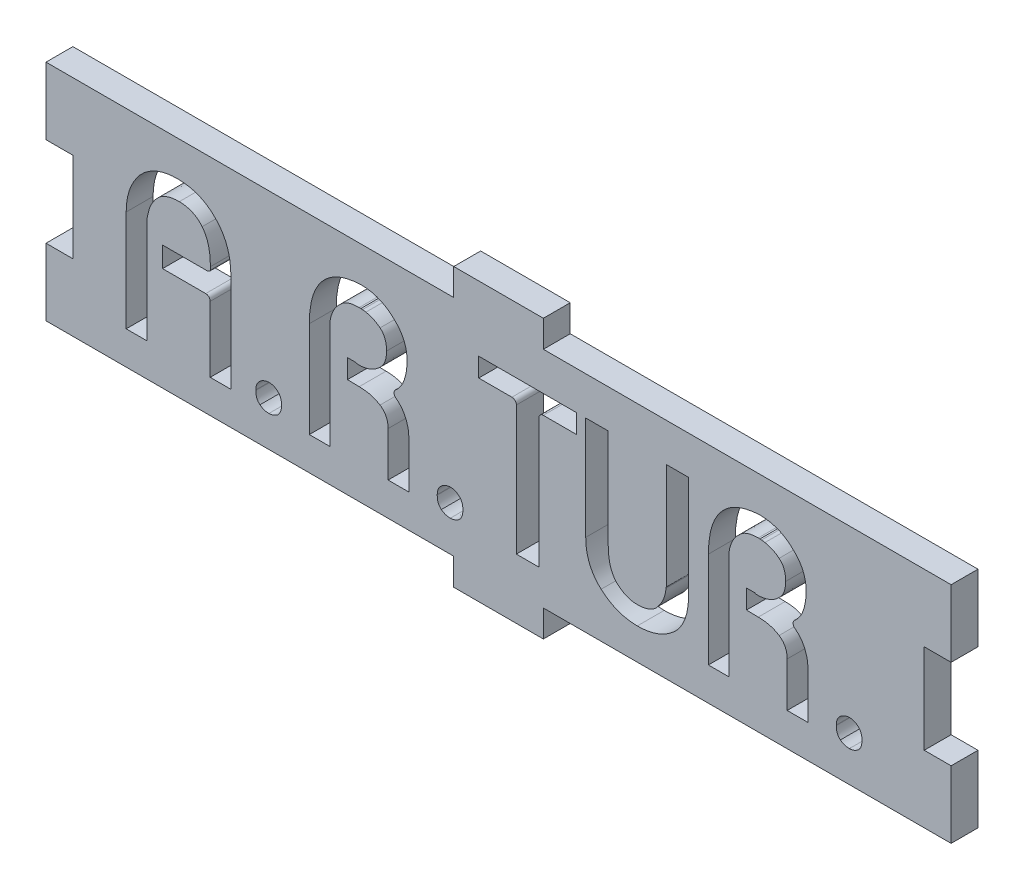
from build123d import *

# Parameters (mm, degrees)
ESQUISSE1_W             = 202
ESQUISSE1_H             = 50
BOSS_EXTRU_1_DEPTH      = 6
ENL_V_MAT_EXTRU_3_REACH = 106.221
ENL_V_MAT_EXTRU_4_REACH = 106.221
ESQUISSE4_W             = 6
ESQUISSE4_H             = 20
ESQUISSE5_W             = 20
ESQUISSE5_H             = 6
BOSS_EXTRU_2_DEPTH      = 6
ESQUISSE6_W             = 6
ESQUISSE6_H             = 4.561334753
BOSS_EXTRU_3_DEPTH      = 2
ESQUISSE7_W             = 6
ESQUISSE7_H             = 4.223978716
BOSS_EXTRU_4_DEPTH      = 2
ESQUISSE8_W             = 6
ESQUISSE8_H             = 4.223978716
BOSS_EXTRU_5_DEPTH      = 2
BOSS_EXTRU_6_REACH      = 108.638
ESQUISSE9_W             = 2
ESQUISSE9_H             = 6
BOSS_EXTRU_7_REACH      = 108.638
ESQUISSE10_W            = 2
ESQUISSE10_H            = 6
CONG_1_R                = 1
CONG_2_R                = 1
CONG_3_R                = 1
CONG_5_R                = 1
CONG_6_R                = 1


with BuildPart() as part:
    # Esquisse1 → Boss.-Extru.1 (new body)
    with BuildSketch(Plane.XY):
        Rectangle(ESQUISSE1_W, ESQUISSE1_H)
    extrude(amount=BOSS_EXTRU_1_DEPTH)

    # Esquisse3 → Enlèv. mat.-Extru.3 (cut, up to next)
    with BuildSketch(Plane.XY.offset(6), mode=Mode.PRIVATE) as enl_v_mat_extru_3_sk1:
        with BuildLine():
            Line((-83.102372291, -17.6), (-83.102372291, 4.988797988))
            add(Edge.make_bspline(
                [(-83.102372291, 4.988797988), (-83.092949675, 5.40390946), (-83.074474621, 6.217824362), (-82.928161922, 7.413883793), (-82.702489337, 8.561134049), (-82.365965622, 9.657730126), (-81.945713245, 10.711620833), (-81.420249619, 11.717859176), (-80.810673329, 12.687759692), (-80.334299867, 13.288630517), (-80.09428096, 13.591376935)],
                knots=[0, 0, 0, 0, 1.070056633, 2.098075088, 3.102701335, 4.081123745, 5.051437982, 6.024081097, 7.004440979, 8, 8, 8, 8], degree=3))
            add(Edge.make_bspline(
                [(-80.09428096, 13.591376935), (-79.828777775, 13.872098531), (-79.304302249, 14.426636538), (-78.410095479, 15.140317174), (-77.455694847, 15.754476186), (-76.424329439, 16.257125986), (-75.322014921, 16.653193397), (-74.143135808, 16.930597271), (-72.890777242, 17.103746811), (-72.031118657, 17.123487816), (-71.590097523, 17.133615325)],
                knots=[0, 0, 0, 0, 0.974449976, 1.924930451, 2.879798784, 3.834685434, 4.814987156, 5.830638503, 6.88707647, 8, 8, 8, 8], degree=3))
            add(Edge.make_bspline(
                [(-71.590097523, 17.133615325), (-71.170248689, 17.122468537), (-70.343784638, 17.100526307), (-69.133116, 16.937910349), (-67.976654601, 16.663009541), (-66.877454915, 16.27457455), (-65.832745601, 15.782259134), (-64.849097512, 15.180797247), (-63.925708524, 14.467639525), (-63.372967205, 13.914017488), (-63.092942337, 13.63354644)],
                knots=[0, 0, 0, 0, 1.064931283, 2.096295975, 3.09241473, 4.075522731, 5.048572496, 6.016927927, 6.995353749, 8, 8, 8, 8], degree=3))
            add(Edge.make_bspline(
                [(-63.092942337, 13.63354644), (-62.821079076, 13.337189325), (-62.278306348, 12.745514825), (-61.592405699, 11.75340296), (-61.008804489, 10.692623874), (-60.547818029, 9.550639645), (-60.180888697, 8.339606862), (-59.921752265, 7.047812098), (-59.765838178, 5.679098523), (-59.749047734, 4.738544543), (-59.740466718, 4.257859907)],
                knots=[0, 0, 0, 0, 0.943498659, 1.88368718, 2.824197585, 3.781502294, 4.770088047, 5.791872426, 6.871502305, 8, 8, 8, 8], degree=3))
            add(Edge.make_bspline(
                [(-59.740466718, 4.257859907), (-59.740466718, 4.243803406), (-59.740466718, 4.220375903), (-59.740466718, 4.1922629), (-59.740466718, 4.175863648), (-59.740466718, 4.168835397), (-59.740466718, 4.166492647)],
                knots=[0, 0, 0, 0, 1.846153846, 3.076923077, 3.692307692, 4, 4, 4, 4], degree=3))
            add(Edge.make_bspline(
                [(-59.740466718, 4.166492647), (-59.740466718, 4.152436146), (-59.740466718, 4.126665893), (-59.740466718, 4.091524639), (-59.740466718, 4.056383385), (-59.740466718, 4.032955882), (-59.740466718, 4.018899381)],
                knots=[0, 0, 0, 0, 1.142857143, 2.095238095, 2.857142857, 4, 4, 4, 4], degree=3))
            add(Edge.make_bspline(
                [(-59.740466718, 4.018899381), (-59.740466718, 4.002500129), (-59.740466718, 3.969701625), (-59.740466718, 3.92050387), (-59.740466718, 3.871306115), (-59.740466718, 3.838507611), (-59.740466718, 3.822108359)],
                knots=[0, 0, 0, 0, 1, 2, 3, 4, 4, 4, 4], degree=3))
            add(Edge.make_bspline(
                [(-59.740466718, 3.822108359), (-59.740466718, 3.803366357), (-59.740466718, 3.763539603), (-59.740466718, 3.697942595), (-59.740466718, 3.620631837), (-59.740466718, 3.564405831), (-59.740466718, 3.533950077)],
                knots=[0, 0, 0, 0, 0.780487805, 1.658536585, 2.731707317, 4, 4, 4, 4], degree=3))
            add(Edge.make_bspline(
                [(-59.740466718, 3.533950077), (-59.740466718, 3.517550826), (-59.740466718, 3.484752322), (-59.740466718, 3.435554567), (-59.740466718, 3.386356811), (-59.740466718, 3.353558308), (-59.740466718, 3.337159056)],
                knots=[0, 0, 0, 0, 1, 2, 3, 4, 4, 4, 4], degree=3))
            Line((-59.740466718, 3.337159056), (-59.740466718, -17.6))
            Line((-59.740466718, -17.6), (-64.350999226, -17.6))
            Line((-64.350999226, -17.6), (-64.350999226, -1.905916022))
            Line((-64.350999226, -1.905916022), (-76.987794118, -1.905916022))
            Line((-76.987794118, -1.905916022), (-76.987794118, 2.655418731))
            Line((-76.987794118, 2.655418731), (-64.350999226, 2.655418731))
            add(Edge.make_bspline(
                [(-64.350999226, 2.655418731), (-64.350999226, 2.662446981), (-64.350999226, 2.685874484), (-64.350999226, 2.732729489), (-64.350999226, 2.791298246), (-64.350999226, 2.83346775), (-64.350999226, 2.852209752)],
                knots=[0, 0, 0, 0, 0.428571429, 1.428571429, 2.857142857, 4, 4, 4, 4], degree=3))
            add(Edge.make_bspline(
                [(-64.350999226, 2.852209752), (-64.350765827, 2.868603748), (-64.350299028, 2.901391741), (-64.353846716, 2.951325611), (-64.338984044, 3.004598761), (-64.314864967, 3.033400844), (-64.301801471, 3.049000774)],
                knots=[0, 0, 0, 0, 0.937005296, 1.874010592, 2.84851081, 4, 4, 4, 4], degree=3))
            add(Edge.make_bspline(
                [(-64.301801471, 3.049000774), (-64.301801471, 3.053686275), (-64.301801471, 3.067742776), (-64.301801471, 3.098198529), (-64.301801471, 3.140368034), (-64.301801471, 3.173166538), (-64.301801471, 3.189565789)],
                knots=[0, 0, 0, 0, 0.4, 1.2, 2.6, 4, 4, 4, 4], degree=3))
            add(Edge.make_bspline(
                [(-64.301801471, 3.189565789), (-64.301801471, 3.220021543), (-64.301801471, 3.276247549), (-64.301801471, 3.355901058), (-64.301801471, 3.423840815), (-64.301801471, 3.46601032), (-64.301801471, 3.484752322)],
                knots=[0, 0, 0, 0, 1.238095238, 2.285714286, 3.238095238, 4, 4, 4, 4], degree=3))
            add(Edge.make_bspline(
                [(-64.301801471, 3.484752322), (-64.301801471, 3.501151574), (-64.301801471, 3.533950077), (-64.301801471, 3.583147833), (-64.301801471, 3.630002838), (-64.301801471, 3.660458591), (-64.301801471, 3.674515093)],
                knots=[0, 0, 0, 0, 1.037037037, 2.074074074, 3.111111111, 4, 4, 4, 4], degree=3))
            add(Edge.make_bspline(
                [(-64.301801471, 3.674515093), (-64.301801471, 3.679200593), (-64.301801471, 3.695599845), (-64.301801471, 3.728398349), (-64.301801471, 3.772910604), (-64.301801471, 3.805709107), (-64.301801471, 3.822108359)],
                knots=[0, 0, 0, 0, 0.380952381, 1.333333333, 2.666666667, 4, 4, 4, 4], degree=3))
            add(Edge.make_bspline(
                [(-64.301801471, 3.822108359), (-64.307024014, 4.190068887), (-64.317151128, 4.903586858), (-64.399981736, 5.93939485), (-64.546514039, 6.902264108), (-64.749447713, 7.793161411), (-65.007131916, 8.610438836), (-65.32364891, 9.356197382), (-65.701931434, 10.028166041), (-66.00298045, 10.429266398), (-66.150231424, 10.625455108)],
                knots=[0, 0, 0, 0, 1.228968542, 2.38311198, 3.467697717, 4.479462079, 5.432252885, 6.326186899, 7.181294084, 8, 8, 8, 8], degree=3))
            add(Edge.make_bspline(
                [(-66.150231424, 10.625455108), (-66.307762348, 10.805216678), (-66.618705429, 11.160039814), (-67.15504516, 11.619216054), (-67.732525384, 12.017171391), (-68.360132612, 12.338083878), (-69.026513377, 12.594608438), (-69.734047066, 12.775290246), (-70.480426803, 12.892297343), (-70.992246275, 12.903788222), (-71.252741486, 12.90963661)],
                knots=[0, 0, 0, 0, 0.990712156, 1.955521383, 2.920820236, 3.894744745, 4.873267486, 5.877715849, 6.919844033, 8, 8, 8, 8], degree=3))
            add(Edge.make_bspline(
                [(-71.252741486, 12.90963661), (-71.496674892, 12.907264293), (-71.971815911, 12.902643419), (-72.661524962, 12.818429936), (-73.312758383, 12.706317479), (-73.917756246, 12.526362361), (-74.478007995, 12.311577584), (-74.993200034, 12.056291082), (-75.459916821, 11.756370946), (-75.734731296, 11.516764757), (-75.870302245, 11.398562693)],
                knots=[0, 0, 0, 0, 1.176399509, 2.291427287, 3.349265731, 4.361905875, 5.331989761, 6.242172059, 7.132831703, 8, 8, 8, 8], degree=3))
            add(Edge.make_bspline(
                [(-75.870302245, 11.398562693), (-76.114400054, 11.154407205), (-76.591461634, 10.677232897), (-77.166692333, 9.866053774), (-77.622837634, 9.022278473), (-77.846727418, 8.435369278), (-77.957692724, 8.144482585)],
                knots=[0, 0, 0, 0, 1.05958582, 2.070840728, 3.043861015, 4, 4, 4, 4], degree=3))
            add(Edge.make_bspline(
                [(-77.957692724, 8.144482585), (-78.000716745, 7.999476712), (-78.08641238, 7.7106527), (-78.199268787, 7.274715811), (-78.294336409, 6.837063024), (-78.360408318, 6.546671937), (-78.393444272, 6.401476393)],
                knots=[0, 0, 0, 0, 1.00988184, 2.011491803, 3.005745901, 4, 4, 4, 4], degree=3))
            add(Edge.make_bspline(
                [(-78.393444272, 6.401476393), (-78.407352957, 6.260910401), (-78.434000309, 5.991603005), (-78.474522715, 5.605660816), (-78.485531775, 5.241867631), (-78.489737534, 5.007534118), (-78.491839783, 4.890402477)],
                knots=[0, 0, 0, 0, 1.118848889, 2.14357881, 3.07206759, 4, 4, 4, 4], degree=3))
            Line((-78.491839783, 4.890402477), (-78.491839783, -17.6))
            Line((-78.491839783, -17.6), (-83.102372291, -17.6))
        make_face()
    enl_v_mat_extru_3_tool1 = extrude(enl_v_mat_extru_3_sk1.sketch, amount=-ENL_V_MAT_EXTRU_3_REACH, mode=Mode.PRIVATE) & part.part
    # Esquisse3 → Enlèv. mat.-Extru.3 (cut, up to next)
    with BuildSketch(Plane.XY.offset(6), mode=Mode.PRIVATE) as enl_v_mat_extru_3_sk2:
        with BuildLine():
            add(Edge.make_bspline(
                [(-54.174092105, -14.929264706), (-54.163600311, -14.72419675), (-54.143227617, -14.326001122), (-53.975244075, -13.758536598), (-53.704755387, -13.246856526), (-53.436487202, -12.976709959), (-53.302589009, -12.841874226)],
                knots=[0, 0, 0, 0, 1.054600379, 2.047795612, 3.025614461, 4, 4, 4, 4], degree=3))
            add(Edge.make_bspline(
                [(-53.302589009, -12.841874226), (-53.154531954, -12.720683836), (-52.869816804, -12.487633541), (-52.380188948, -12.248250259), (-51.878738801, -12.079908599), (-51.530348082, -12.035030045), (-51.355763545, -12.012540635)],
                knots=[0, 0, 0, 0, 1.063594773, 2.045303048, 3.020467982, 4, 4, 4, 4], degree=3))
            add(Edge.make_bspline(
                [(-51.355763545, -12.012540635), (-51.351078044, -12.012540635), (-51.334678793, -12.012540635), (-51.318279541, -12.012540635), (-51.306565789, -12.012540635)],
                knots=[0, 0, 0, 0, 0.571428571, 2, 2, 2, 2], degree=3))
            add(Edge.make_bspline(
                [(-51.306565789, -12.012540635), (-51.304223039, -12.012540635), (-51.297194788, -12.012540635), (-51.278452786, -12.012540635), (-51.247997033, -12.012540635), (-51.22222678, -12.012540635), (-51.208170279, -12.012540635)],
                knots=[0, 0, 0, 0, 0.285714286, 0.857142857, 2.285714286, 4, 4, 4, 4], degree=3))
            add(Edge.make_bspline(
                [(-51.208170279, -12.012540635), (-51.036111397, -12.01951332), (-50.69819895, -12.03320722), (-50.208159882, -12.177048502), (-49.736815974, -12.403487604), (-49.461061808, -12.627113243), (-49.31757082, -12.743478715)],
                knots=[0, 0, 0, 0, 0.993501924, 1.951173132, 2.933875801, 4, 4, 4, 4], degree=3))
            add(Edge.make_bspline(
                [(-49.31757082, -12.743478715), (-49.182505005, -12.870348994), (-48.903547787, -13.132379618), (-48.636768572, -13.679227357), (-48.465569863, -14.318912739), (-48.44821006, -14.782672119), (-48.439039474, -15.027660217)],
                knots=[0, 0, 0, 0, 0.873343845, 1.803754468, 2.839799172, 4, 4, 4, 4], degree=3))
            add(Edge.make_bspline(
                [(-48.439039474, -15.027660217), (-48.448301747, -15.270264703), (-48.465914936, -15.731602711), (-48.638742072, -16.373285449), (-48.908490778, -16.930709362), (-49.182958965, -17.214719537), (-49.31757082, -17.354011223)],
                knots=[0, 0, 0, 0, 1.134974735, 2.158274115, 3.096732702, 4, 4, 4, 4], degree=3))
            add(Edge.make_bspline(
                [(-49.31757082, -17.354011223), (-49.466168604, -17.445308795), (-49.763001621, -17.627681192), (-50.231065983, -17.859822021), (-50.735822033, -18.006250317), (-51.083076031, -18.025892727), (-51.257368034, -18.035751548)],
                knots=[0, 0, 0, 0, 1.003202675, 2.003957737, 2.998156372, 4, 4, 4, 4], degree=3))
            add(Edge.make_bspline(
                [(-51.257368034, -18.035751548), (-51.433861009, -18.027563869), (-51.789000621, -18.0110886), (-52.308423864, -17.87917779), (-52.810743245, -17.672513208), (-53.104711184, -17.460992156), (-53.253391254, -17.354011223)],
                knots=[0, 0, 0, 0, 0.985163287, 1.982348061, 2.979532834, 4, 4, 4, 4], degree=3))
            add(Edge.make_bspline(
                [(-53.253391254, -17.354011223), (-53.400500434, -17.215941043), (-53.696038366, -16.938562191), (-53.985509035, -16.377418442), (-54.14393965, -15.730090063), (-54.163691694, -15.269947585), (-54.174092105, -15.027660217)],
                knots=[0, 0, 0, 0, 0.929924183, 1.868189794, 2.877498366, 4, 4, 4, 4], degree=3))
            Line((-54.174092105, -15.027660217), (-54.174092105, -14.929264706))
        make_face()
    enl_v_mat_extru_3_tool2 = extrude(enl_v_mat_extru_3_sk2.sketch, amount=-ENL_V_MAT_EXTRU_3_REACH, mode=Mode.PRIVATE) & part.part
    # Esquisse3 → Enlèv. mat.-Extru.3 (cut, up to next)
    with BuildSketch(Plane.XY.offset(6), mode=Mode.PRIVATE) as enl_v_mat_extru_3_sk3:
        with BuildLine():
            Line((-42.23309404, -17.6), (-42.23309404, 3.822108359))
            add(Edge.make_bspline(
                [(-42.23309404, 3.822108359), (-42.226151894, 4.326138767), (-42.212628984, 5.307961579), (-42.074694422, 6.735286866), (-41.86277896, 8.075689269), (-41.552880443, 9.326772182), (-41.154773261, 10.490788074), (-40.659925778, 11.567690798), (-40.073870543, 12.560196271), (-39.599976662, 13.15136526), (-39.365567724, 13.443783669)],
                knots=[0, 0, 0, 0, 1.179465841, 2.29753295, 3.353222995, 4.353387927, 5.310675874, 6.228348747, 7.123662693, 8, 8, 8, 8], degree=3))
            add(Edge.make_bspline(
                [(-39.365567724, 13.443783669), (-39.121693683, 13.717775155), (-38.634170173, 14.265505819), (-37.775767399, 14.966634997), (-36.838643825, 15.587417004), (-35.794376991, 16.08844433), (-34.665702894, 16.506161911), (-33.445275857, 16.817750041), (-32.13811315, 17.039653261), (-31.234739754, 17.101697753), (-30.770017028, 17.133615325)],
                knots=[0, 0, 0, 0, 0.912478216, 1.82411617, 2.751644032, 3.706940466, 4.702190389, 5.745444488, 6.840188135, 8, 8, 8, 8], degree=3))
            add(Edge.make_bspline(
                [(-30.770017028, 17.133615325), (-30.427647605, 17.125390524), (-29.749907208, 17.109109047), (-28.751056437, 16.983358939), (-27.78922204, 16.759033008), (-26.856216318, 16.469069766), (-25.962129269, 16.076572128), (-25.099185222, 15.609347435), (-24.284856227, 15.033487106), (-23.784586325, 14.589575164), (-23.530918731, 14.36448452)],
                knots=[0, 0, 0, 0, 1.034309447, 2.047476348, 3.034821847, 4.015318387, 4.994945852, 5.980157755, 6.975815814, 8, 8, 8, 8], degree=3))
            add(Edge.make_bspline(
                [(-23.530918731, 14.36448452), (-23.281632495, 14.138077508), (-22.793375739, 13.694632433), (-22.167524524, 12.945063198), (-21.626131532, 12.16497095), (-21.193998208, 11.33811088), (-20.841451699, 10.486613518), (-20.607535868, 9.599623963), (-20.451323817, 8.688836491), (-20.433451987, 8.070174105), (-20.424431889, 7.757928793)],
                knots=[0, 0, 0, 0, 1.071402239, 2.098468779, 3.102259339, 4.090284332, 5.064376597, 6.03098092, 7.006215681, 8, 8, 8, 8], degree=3))
            add(Edge.make_bspline(
                [(-20.424431889, 7.757928793), (-20.424431889, 7.739186791), (-20.424431889, 7.697017286), (-20.424431889, 7.629077528), (-20.424431889, 7.55176677), (-20.424431889, 7.497883514), (-20.424431889, 7.469770511)],
                knots=[0, 0, 0, 0, 0.780487805, 1.756097561, 2.829268293, 4, 4, 4, 4], degree=3))
            add(Edge.make_bspline(
                [(-20.424431889, 7.469770511), (-20.424431889, 7.451028509), (-20.424431889, 7.408859004), (-20.424431889, 7.340919247), (-20.424431889, 7.261265738), (-20.424431889, 7.205039732), (-20.424431889, 7.174583978)],
                knots=[0, 0, 0, 0, 0.761904762, 1.714285714, 2.761904762, 4, 4, 4, 4], degree=3))
            add(Edge.make_bspline(
                [(-20.424431889, 7.174583978), (-20.436700973, 6.791920273), (-20.46107857, 6.031600981), (-20.652372058, 4.916243241), (-20.938523061, 3.835284456), (-21.20946538, 3.147434884), (-21.34513274, 2.803011997)],
                knots=[0, 0, 0, 0, 1.020809319, 2.028258779, 3.012701566, 4, 4, 4, 4], degree=3))
            add(Edge.make_bspline(
                [(-21.34513274, 2.803011997), (-21.516652382, 2.479454012), (-21.851420387, 1.847941144), (-22.535819013, 1.037430808), (-23.333559031, 0.361175813), (-23.949972713, 0.045838001), (-24.261856811, -0.113712074)],
                knots=[0, 0, 0, 0, 1.041192477, 2.032174995, 3.004348305, 4, 4, 4, 4], degree=3))
            add(Edge.make_bspline(
                [(-24.261856811, -0.113712074), (-23.946926179, -0.268175286), (-23.325929116, -0.572754108), (-22.49438437, -1.196029604), (-21.737486906, -1.932003488), (-21.348398588, -2.52747339), (-21.148341718, -2.833645124)],
                knots=[0, 0, 0, 0, 1.000493697, 1.972826981, 2.957691943, 4, 4, 4, 4], degree=3))
            add(Edge.make_bspline(
                [(-21.148341718, -2.833645124), (-20.982184853, -3.148275586), (-20.645856954, -3.785137636), (-20.30805151, -4.822482287), (-20.066699192, -5.901033655), (-20.042800352, -6.639272898), (-20.030849845, -7.008426084)],
                knots=[0, 0, 0, 0, 0.975776978, 1.975127657, 2.987471768, 4, 4, 4, 4], degree=3))
            Line((-20.030849845, -7.008426084), (-20.030849845, -17.6))
            Line((-20.030849845, -17.6), (-24.648410604, -17.6))
            Line((-24.648410604, -17.6), (-24.648410604, -7.640968653))
            add(Edge.make_bspline(
                [(-24.648410604, -7.640968653), (-24.653718845, -7.443905698), (-24.664070912, -7.059595982), (-24.747042758, -6.50182528), (-24.896368343, -5.982894056), (-25.103126625, -5.503681138), (-25.351457034, -5.055929221), (-25.670276959, -4.661596751), (-26.024951633, -4.294582338), (-26.305797945, -4.099077072), (-26.447642802, -4.000334752)],
                knots=[0, 0, 0, 0, 1.114967711, 2.174396123, 3.181511139, 4.161646928, 5.123680777, 6.067917283, 7.024178051, 8, 8, 8, 8], degree=3))
            add(Edge.make_bspline(
                [(-26.447642802, -4.000334752), (-26.770455743, -3.815727788), (-27.431723584, -3.437568696), (-28.555102069, -3.071622467), (-29.788907994, -2.820197892), (-30.656134062, -2.796682831), (-31.107373065, -2.784447368)],
                knots=[0, 0, 0, 0, 0.912720846, 1.869667741, 2.891535853, 4, 4, 4, 4], degree=3))
            Line((-31.107373065, -2.784447368), (-35.724933824, -2.686051858))
            Line((-35.724933824, -2.686051858), (-35.724933824, 1.537926858))
            Line((-35.724933824, 1.537926858), (-31.887508901, 1.537926858))
            add(Edge.make_bspline(
                [(-31.887508901, 1.537926858), (-31.856076073, 1.510251084), (-31.797752811, 1.458898993), (-31.694318732, 1.413670372), (-31.594823442, 1.404266567), (-31.531385875, 1.399600255), (-31.500955108, 1.397361842)],
                knots=[0, 0, 0, 0, 1.182697103, 2.194481306, 3.133899354, 4, 4, 4, 4], degree=3))
            add(Edge.make_bspline(
                [(-31.500955108, 1.397361842), (-31.468156605, 1.397361842), (-31.402559598, 1.397361842), (-31.304164087, 1.397361842), (-31.205768576, 1.397361842), (-31.140171569, 1.397361842), (-31.107373065, 1.397361842)],
                knots=[0, 0, 0, 0, 1, 2, 3, 4, 4, 4, 4], degree=3))
            add(Edge.make_bspline(
                [(-31.107373065, 1.397361842), (-31.072231811, 1.397361842), (-30.999606553, 1.397361842), (-30.889497291, 1.397361842), (-30.779388029, 1.397361842), (-30.706762771, 1.397361842), (-30.671621517, 1.397361842)],
                knots=[0, 0, 0, 0, 0.967741935, 2, 3.032258065, 4, 4, 4, 4], degree=3))
            add(Edge.make_bspline(
                [(-30.671621517, 1.397361842), (-30.655231836, 1.397536199), (-30.622452475, 1.397884912), (-30.567896139, 1.39499314), (-30.50247276, 1.411069781), (-30.45792751, 1.433714999), (-30.432660991, 1.446559598)],
                knots=[0, 0, 0, 0, 0.79314293, 1.586285859, 2.630916788, 4, 4, 4, 4], degree=3))
            add(Edge.make_bspline(
                [(-30.432660991, 1.446559598), (-30.413918989, 1.446559598), (-30.374092234, 1.446559598), (-30.310837977, 1.446559598), (-30.24758372, 1.446559598), (-30.205414216, 1.446559598), (-30.186672214, 1.446559598)],
                knots=[0, 0, 0, 0, 0.914285714, 1.942857143, 3.085714286, 4, 4, 4, 4], degree=3))
            add(Edge.make_bspline(
                [(-30.186672214, 1.446559598), (-29.865477854, 1.507284595), (-29.223876692, 1.628585695), (-28.300573543, 1.984942769), (-27.415774265, 2.471677056), (-26.899758412, 2.914982585), (-26.637405573, 3.140368034)],
                knots=[0, 0, 0, 0, 0.981007491, 1.959609586, 2.962624468, 4, 4, 4, 4], degree=3))
            add(Edge.make_bspline(
                [(-26.637405573, 3.140368034), (-26.505798033, 3.25937099), (-26.244620274, 3.495534704), (-25.901142154, 3.90041795), (-25.623147617, 4.354074456), (-25.388399688, 4.843455303), (-25.203929323, 5.373341172), (-25.08258895, 5.942627118), (-25.001757042, 6.54678156), (-24.991203802, 6.961114463), (-24.985766641, 7.174583978)],
                knots=[0, 0, 0, 0, 0.944183768, 1.873751319, 2.815211831, 3.76931437, 4.759511945, 5.794580443, 6.863740143, 8, 8, 8, 8], degree=3))
            add(Edge.make_bspline(
                [(-24.985766641, 7.174583978), (-24.988947539, 7.378642469), (-24.995146941, 7.776341764), (-25.067806573, 8.349847072), (-25.177753323, 8.885318071), (-25.340623475, 9.376906597), (-25.542789274, 9.832468189), (-25.79718059, 10.240122088), (-26.094179703, 10.607929201), (-26.329549564, 10.81148325), (-26.447642802, 10.91361339)],
                knots=[0, 0, 0, 0, 1.178060027, 2.295977203, 3.333782085, 4.330908085, 5.281779262, 6.205590154, 7.099682225, 8, 8, 8, 8], degree=3))
            add(Edge.make_bspline(
                [(-26.447642802, 10.91361339), (-26.689540454, 11.095468677), (-27.164689389, 11.452679031), (-27.939101204, 11.876618343), (-28.751289668, 12.196624938), (-29.317607821, 12.31550967), (-29.603327399, 12.375489551)],
                knots=[0, 0, 0, 0, 1.032112255, 2.027332774, 3.004747339, 4, 4, 4, 4], degree=3))
            add(Edge.make_bspline(
                [(-29.603327399, 12.375489551), (-29.6687173, 12.390716634), (-29.798694741, 12.420983957), (-29.994333004, 12.44519963), (-30.188389152, 12.470686212), (-30.317772916, 12.472807863), (-30.383463235, 12.473885062)],
                knots=[0, 0, 0, 0, 1.021753461, 2.030969595, 3.000290038, 4, 4, 4, 4], degree=3))
            add(Edge.make_bspline(
                [(-30.383463235, 12.473885062), (-30.413933589, 12.474106033), (-30.47721817, 12.474564972), (-30.568743129, 12.471082715), (-30.653846297, 12.482138029), (-30.700118073, 12.505571039), (-30.720819272, 12.516054567)],
                knots=[0, 0, 0, 0, 1.060913082, 2.203434863, 3.196247532, 4, 4, 4, 4], degree=3))
            add(Edge.make_bspline(
                [(-30.720819272, 12.516054567), (-30.753617776, 12.516054567), (-30.819214783, 12.516054567), (-30.915267544, 12.516054567), (-31.011320304, 12.516054567), (-31.074574561, 12.516054567), (-31.107373065, 12.516054567)],
                knots=[0, 0, 0, 0, 1.018181818, 2.036363636, 2.981818182, 4, 4, 4, 4], degree=3))
            add(Edge.make_bspline(
                [(-31.107373065, 12.516054567), (-31.320674767, 12.511599071), (-31.733986156, 12.502965726), (-32.333428789, 12.448248591), (-32.893200014, 12.350321099), (-33.412566851, 12.209954744), (-33.892821419, 12.034512224), (-34.336411601, 11.823476142), (-34.737077564, 11.564342803), (-34.975070731, 11.35914934), (-35.092391254, 11.257997678)],
                knots=[0, 0, 0, 0, 1.196716369, 2.318858688, 3.373380872, 4.380903618, 5.333156405, 6.238443452, 7.131627443, 8, 8, 8, 8], degree=3))
            add(Edge.make_bspline(
                [(-35.092391254, 11.257997678), (-35.32045101, 11.047755769), (-35.760485464, 10.642100314), (-36.31118441, 9.966134448), (-36.759413171, 9.271482081), (-36.975079005, 8.780220203), (-37.081386223, 8.538064628)],
                knots=[0, 0, 0, 0, 1.093258391, 2.109409256, 3.068079353, 4, 4, 4, 4], degree=3))
            add(Edge.make_bspline(
                [(-37.081386223, 8.538064628), (-37.127105111, 8.423719405), (-37.216839312, 8.199289681), (-37.329365347, 7.858359519), (-37.426256817, 7.516764316), (-37.491323224, 7.28936542), (-37.524166022, 7.174583978)],
                knots=[0, 0, 0, 0, 1.029919799, 2.021462798, 3.001317259, 4, 4, 4, 4], degree=3))
            add(Edge.make_bspline(
                [(-37.524166022, 7.174583978), (-37.539102904, 7.066924246), (-37.568265652, 6.85672953), (-37.595593904, 6.554158255), (-37.609527115, 6.272746861), (-37.613567304, 6.094587587), (-37.615533282, 6.00789435)],
                knots=[0, 0, 0, 0, 1.113557543, 2.174108249, 3.111511493, 4, 4, 4, 4], degree=3))
            Line((-37.615533282, 6.00789435), (-37.615533282, -17.6))
            Line((-37.615533282, -17.6), (-42.23309404, -17.6))
        make_face()
    enl_v_mat_extru_3_tool3 = extrude(enl_v_mat_extru_3_sk3.sketch, amount=-ENL_V_MAT_EXTRU_3_REACH, mode=Mode.PRIVATE) & part.part
    # Esquisse3 → Enlèv. mat.-Extru.3 (cut, up to next)
    with BuildSketch(Plane.XY.offset(6), mode=Mode.PRIVATE) as enl_v_mat_extru_3_sk4:
        with BuildLine():
            add(Edge.make_bspline(
                [(-13.691367647, -14.929264706), (-13.680875853, -14.72419675), (-13.660503159, -14.326001122), (-13.492519616, -13.758536598), (-13.222030928, -13.246856526), (-12.953762744, -12.976709959), (-12.819864551, -12.841874226)],
                knots=[0, 0, 0, 0, 1.054600379, 2.047795612, 3.025614461, 4, 4, 4, 4], degree=3))
            add(Edge.make_bspline(
                [(-12.819864551, -12.841874226), (-12.671807496, -12.720683836), (-12.387092345, -12.487633541), (-11.89746449, -12.248250259), (-11.396014342, -12.079908599), (-11.047623624, -12.035030045), (-10.873039087, -12.012540635)],
                knots=[0, 0, 0, 0, 1.063594773, 2.045303048, 3.020467982, 4, 4, 4, 4], degree=3))
            add(Edge.make_bspline(
                [(-10.873039087, -12.012540635), (-10.868353586, -12.012540635), (-10.851954334, -12.012540635), (-10.835555083, -12.012540635), (-10.823841331, -12.012540635)],
                knots=[0, 0, 0, 0, 0.571428571, 2, 2, 2, 2], degree=3))
            add(Edge.make_bspline(
                [(-10.823841331, -12.012540635), (-10.821498581, -12.012540635), (-10.81447033, -12.012540635), (-10.795728328, -12.012540635), (-10.765272575, -12.012540635), (-10.739502322, -12.012540635), (-10.72544582, -12.012540635)],
                knots=[0, 0, 0, 0, 0.285714286, 0.857142857, 2.285714286, 4, 4, 4, 4], degree=3))
            add(Edge.make_bspline(
                [(-10.72544582, -12.012540635), (-10.553386939, -12.01951332), (-10.215474492, -12.03320722), (-9.725435424, -12.177048502), (-9.254091516, -12.403487604), (-8.97833735, -12.627113243), (-8.834846362, -12.743478715)],
                knots=[0, 0, 0, 0, 0.993501924, 1.951173132, 2.933875801, 4, 4, 4, 4], degree=3))
            add(Edge.make_bspline(
                [(-8.834846362, -12.743478715), (-8.699780546, -12.870348994), (-8.420823329, -13.132379618), (-8.154044114, -13.679227357), (-7.982845405, -14.318912739), (-7.965485601, -14.782672119), (-7.956315015, -15.027660217)],
                knots=[0, 0, 0, 0, 0.873343845, 1.803754468, 2.839799172, 4, 4, 4, 4], degree=3))
            add(Edge.make_bspline(
                [(-7.956315015, -15.027660217), (-7.965577289, -15.270264703), (-7.983190478, -15.731602711), (-8.156017613, -16.373285449), (-8.42576632, -16.930709362), (-8.700234507, -17.214719537), (-8.834846362, -17.354011223)],
                knots=[0, 0, 0, 0, 1.134974735, 2.158274115, 3.096732702, 4, 4, 4, 4], degree=3))
            add(Edge.make_bspline(
                [(-8.834846362, -17.354011223), (-8.983444145, -17.445308795), (-9.280277163, -17.627681192), (-9.748341525, -17.859822021), (-10.253097575, -18.006250317), (-10.600351572, -18.025892727), (-10.774643576, -18.035751548)],
                knots=[0, 0, 0, 0, 1.003202675, 2.003957737, 2.998156372, 4, 4, 4, 4], degree=3))
            add(Edge.make_bspline(
                [(-10.774643576, -18.035751548), (-10.951136551, -18.027563869), (-11.306276163, -18.0110886), (-11.825699406, -17.87917779), (-12.328018786, -17.672513208), (-12.621986726, -17.460992156), (-12.770666796, -17.354011223)],
                knots=[0, 0, 0, 0, 0.985163287, 1.982348061, 2.979532834, 4, 4, 4, 4], degree=3))
            add(Edge.make_bspline(
                [(-12.770666796, -17.354011223), (-12.917775976, -17.215941043), (-13.213313908, -16.938562191), (-13.502784577, -16.377418442), (-13.661215192, -15.730090063), (-13.680967236, -15.269947585), (-13.691367647, -15.027660217)],
                knots=[0, 0, 0, 0, 0.929924183, 1.868189794, 2.877498366, 4, 4, 4, 4], degree=3))
            Line((-13.691367647, -15.027660217), (-13.691367647, -14.929264706))
        make_face()
    enl_v_mat_extru_3_tool4 = extrude(enl_v_mat_extru_3_sk4.sketch, amount=-ENL_V_MAT_EXTRU_3_REACH, mode=Mode.PRIVATE) & part.part
    # Esquisse3 → Enlèv. mat.-Extru.3 (cut, up to next)
    with BuildSketch(Plane.XY.offset(6), mode=Mode.PRIVATE) as enl_v_mat_extru_3_sk5:
        Polygon((-4.421104876, 12.227896285), (-4.421104876, 16.451875), (17.387557276, 16.451875), (17.387557276, 12.227896285), (8.98176935, 12.227896285), (8.98176935, -17.6), (3.977654799, -17.6), (3.977654799, 12.227896285), align=None)
    enl_v_mat_extru_3_tool5 = extrude(enl_v_mat_extru_3_sk5.sketch, amount=-ENL_V_MAT_EXTRU_3_REACH, mode=Mode.PRIVATE) & part.part
    # Esquisse3 → Enlèv. mat.-Extru.3 (cut, up to next)
    with BuildSketch(Plane.XY.offset(6), mode=Mode.PRIVATE) as enl_v_mat_extru_3_sk6:
        with BuildLine():
            Line((19.453863003, 16.451875), (24.457977554, 16.451875))
            Line((24.457977554, 16.451875), (24.457977554, -5.356787152))
            add(Edge.make_bspline(
                [(24.457977554, -5.356787152), (24.462391164, -5.73883946), (24.470853409, -6.471350986), (24.561809286, -7.523752991), (24.715938587, -8.481853063), (24.921448992, -9.351983058), (25.197521685, -10.130804258), (25.526522716, -10.826572625), (25.919970932, -11.442879434), (26.240293704, -11.791801483), (26.397774768, -11.963342879)],
                knots=[0, 0, 0, 0, 1.298861916, 2.490316912, 3.587787158, 4.596338159, 5.526051681, 6.391865977, 7.209389158, 8, 8, 8, 8], degree=3))
            add(Edge.make_bspline(
                [(26.397774768, -11.963342879), (26.561689417, -12.11149355), (26.883504885, -12.402359424), (27.403829527, -12.785126801), (27.940565693, -13.115492658), (28.503421382, -13.386440648), (29.087942919, -13.596436292), (29.694410946, -13.752664442), (30.3236032, -13.846731038), (30.75028558, -13.856186973), (30.966137771, -13.860970588)],
                knots=[0, 0, 0, 0, 1.044444942, 2.050570462, 3.050146134, 4.021502903, 4.9994102, 5.983013425, 6.979636861, 8, 8, 8, 8], degree=3))
            add(Edge.make_bspline(
                [(30.966137771, -13.860970588), (31.217112202, -13.856473991), (31.704450765, -13.847742562), (32.413099843, -13.754218182), (33.072622406, -13.601739682), (33.685807145, -13.388773756), (34.252806548, -13.11842055), (34.764231921, -12.764940258), (35.232859534, -12.353763877), (35.494449182, -12.02840364), (35.625868034, -11.864947368)],
                knots=[0, 0, 0, 0, 1.142842055, 2.219154366, 3.249557427, 4.221708043, 5.171632766, 6.101191801, 7.046066255, 8, 8, 8, 8], degree=3))
            add(Edge.make_bspline(
                [(35.625868034, -11.864947368), (35.869213208, -11.539411686), (36.348950102, -10.897642322), (36.865903634, -9.816578095), (37.23216276, -8.681102145), (37.327673542, -7.891892916), (37.375902477, -7.493375387)],
                knots=[0, 0, 0, 0, 1.018437844, 2.007774393, 2.994009704, 4, 4, 4, 4], degree=3))
            add(Edge.make_bspline(
                [(37.375902477, -7.493375387), (37.376080252, -7.476988623), (37.376410407, -7.446556061), (37.373830757, -7.394320011), (37.390811309, -7.329401457), (37.412443737, -7.282093406), (37.425100232, -7.254414861)],
                knots=[0, 0, 0, 0, 0.795013122, 1.476452941, 2.523547059, 4, 4, 4, 4], degree=3))
            add(Edge.make_bspline(
                [(37.425100232, -7.254414861), (37.425100232, -7.238015609), (37.425100232, -7.205217105), (37.425100232, -7.15601935), (37.425100232, -7.106821594), (37.425100232, -7.074023091), (37.425100232, -7.057623839)],
                knots=[0, 0, 0, 0, 1, 2, 3, 4, 4, 4, 4], degree=3))
            add(Edge.make_bspline(
                [(37.425100232, -7.057623839), (37.425100232, -7.022482585), (37.425100232, -6.949857327), (37.425100232, -6.839748065), (37.425100232, -6.729638803), (37.425100232, -6.657013545), (37.425100232, -6.621872291)],
                knots=[0, 0, 0, 0, 0.967741935, 2, 3.032258065, 4, 4, 4, 4], degree=3))
            Line((37.425100232, -6.621872291), (37.425100232, 16.451875))
            Line((37.425100232, 16.451875), (42.429214783, 16.451875))
            Line((42.429214783, 16.451875), (42.429214783, -6.136922988))
            add(Edge.make_bspline(
                [(42.429214783, -6.136922988), (42.418498696, -6.636376494), (42.397761259, -7.602903297), (42.236809604, -8.998274398), (41.966526257, -10.287530414), (41.577435842, -11.466266714), (41.093435168, -12.547179619), (40.495469577, -13.523935431), (39.804534753, -14.415535612), (39.253140413, -14.917875563), (38.978343653, -15.168225232)],
                knots=[0, 0, 0, 0, 1.200176211, 2.32254346, 3.370587637, 4.360591543, 5.300507084, 6.210168053, 7.108006767, 8, 8, 8, 8], degree=3))
            add(Edge.make_bspline(
                [(38.978343653, -15.168225232), (38.69218851, -15.401376376), (38.127217132, -15.861699126), (37.210153672, -16.444402513), (36.261672484, -16.943768537), (35.265833782, -17.325592536), (34.23825147, -17.624238092), (33.177368153, -17.831890132), (32.082248336, -17.963285643), (31.341354541, -17.978731449), (30.966137771, -17.986553793)],
                knots=[0, 0, 0, 0, 1.019550359, 2.012952711, 2.997768699, 3.977910358, 4.955545613, 5.952551116, 6.963094086, 8, 8, 8, 8], degree=3))
            add(Edge.make_bspline(
                [(30.966137771, -17.986553793), (30.590830357, -17.976924435), (29.849280046, -17.957898291), (28.753667617, -17.811561967), (27.689024623, -17.583221839), (26.65823644, -17.250402264), (25.662295955, -16.820196511), (24.702527746, -16.286822528), (23.769335763, -15.66384846), (23.190828408, -15.176299657), (22.897705882, -14.929264706)],
                knots=[0, 0, 0, 0, 1.020052211, 2.015467871, 2.999921486, 3.976825735, 4.955327438, 5.9445291, 6.958518302, 8, 8, 8, 8], degree=3))
            add(Edge.make_bspline(
                [(22.897705882, -14.929264706), (22.619663564, -14.66586582), (22.068070173, -14.143322757), (21.357664394, -13.260030541), (20.762976299, -12.307416657), (20.272755888, -11.293598803), (19.9125889, -10.206902625), (19.641913251, -9.067107018), (19.488342482, -7.863000687), (19.465524534, -7.04164249), (19.453863003, -6.621872291)],
                knots=[0, 0, 0, 0, 0.989609325, 1.963233392, 2.921390967, 3.888793609, 4.86781259, 5.875923978, 6.914451918, 8, 8, 8, 8], degree=3))
            Line((19.453863003, -6.621872291), (19.453863003, 16.451875))
        make_face()
    enl_v_mat_extru_3_tool6 = extrude(enl_v_mat_extru_3_sk6.sketch, amount=-ENL_V_MAT_EXTRU_3_REACH, mode=Mode.PRIVATE) & part.part
    # Esquisse3 → Enlèv. mat.-Extru.3 (cut, up to next)
    with BuildSketch(Plane.XY.offset(6), mode=Mode.PRIVATE) as enl_v_mat_extru_3_sk7:
        with BuildLine():
            Line((46.828899768, -17.6), (46.828899768, 3.822108359))
            add(Edge.make_bspline(
                [(46.828899768, 3.822108359), (46.835841914, 4.326138767), (46.849364824, 5.307961579), (46.987299386, 6.735286866), (47.199214848, 8.075689269), (47.509113365, 9.326772182), (47.907220548, 10.490788074), (48.40206803, 11.567690798), (48.988123265, 12.560196271), (49.462017146, 13.15136526), (49.696426084, 13.443783669)],
                knots=[0, 0, 0, 0, 1.179465841, 2.29753295, 3.353222995, 4.353387927, 5.310675874, 6.228348747, 7.123662693, 8, 8, 8, 8], degree=3))
            add(Edge.make_bspline(
                [(49.696426084, 13.443783669), (49.940300125, 13.717775155), (50.427823635, 14.265505819), (51.286226409, 14.966634997), (52.223349983, 15.587417004), (53.267616817, 16.08844433), (54.396290914, 16.506161911), (55.616717951, 16.817750041), (56.923880658, 17.039653261), (57.827254054, 17.101697753), (58.29197678, 17.133615325)],
                knots=[0, 0, 0, 0, 0.912478216, 1.82411617, 2.751644032, 3.706940466, 4.702190389, 5.745444488, 6.840188135, 8, 8, 8, 8], degree=3))
            add(Edge.make_bspline(
                [(58.29197678, 17.133615325), (58.634346203, 17.125390524), (59.3120866, 17.109109047), (60.310937371, 16.983358939), (61.272771768, 16.759033008), (62.20577749, 16.469069766), (63.099864539, 16.076572128), (63.962808586, 15.609347435), (64.777137581, 15.033487106), (65.277407483, 14.589575164), (65.531075077, 14.36448452)],
                knots=[0, 0, 0, 0, 1.034309447, 2.047476348, 3.034821847, 4.015318387, 4.994945852, 5.980157755, 6.975815814, 8, 8, 8, 8], degree=3))
            add(Edge.make_bspline(
                [(65.531075077, 14.36448452), (65.780361313, 14.138077508), (66.268618069, 13.694632433), (66.894469284, 12.945063198), (67.435862277, 12.16497095), (67.8679956, 11.33811088), (68.220542109, 10.486613518), (68.454457941, 9.599623963), (68.610669991, 8.688836491), (68.628541822, 8.070174105), (68.63756192, 7.757928793)],
                knots=[0, 0, 0, 0, 1.071402239, 2.098468779, 3.102259339, 4.090284332, 5.064376597, 6.03098092, 7.006215681, 8, 8, 8, 8], degree=3))
            add(Edge.make_bspline(
                [(68.63756192, 7.757928793), (68.63756192, 7.739186791), (68.63756192, 7.697017286), (68.63756192, 7.629077528), (68.63756192, 7.55176677), (68.63756192, 7.497883514), (68.63756192, 7.469770511)],
                knots=[0, 0, 0, 0, 0.780487805, 1.756097561, 2.829268293, 4, 4, 4, 4], degree=3))
            add(Edge.make_bspline(
                [(68.63756192, 7.469770511), (68.63756192, 7.451028509), (68.63756192, 7.408859004), (68.63756192, 7.340919247), (68.63756192, 7.261265738), (68.63756192, 7.205039732), (68.63756192, 7.174583978)],
                knots=[0, 0, 0, 0, 0.761904762, 1.714285714, 2.761904762, 4, 4, 4, 4], degree=3))
            add(Edge.make_bspline(
                [(68.63756192, 7.174583978), (68.625292835, 6.791920273), (68.600915238, 6.031600981), (68.40962175, 4.916243241), (68.123470747, 3.835284456), (67.852528428, 3.147434884), (67.716861068, 2.803011997)],
                knots=[0, 0, 0, 0, 1.020809319, 2.028258779, 3.012701566, 4, 4, 4, 4], degree=3))
            add(Edge.make_bspline(
                [(67.716861068, 2.803011997), (67.545341426, 2.479454012), (67.210573421, 1.847941144), (66.526174795, 1.037430808), (65.728434777, 0.361175813), (65.112021095, 0.045838001), (64.800136997, -0.113712074)],
                knots=[0, 0, 0, 0, 1.041192477, 2.032174995, 3.004348305, 4, 4, 4, 4], degree=3))
            add(Edge.make_bspline(
                [(64.800136997, -0.113712074), (65.115067629, -0.268175286), (65.736064692, -0.572754108), (66.567609438, -1.196029604), (67.324506902, -1.932003488), (67.71359522, -2.52747339), (67.91365209, -2.833645124)],
                knots=[0, 0, 0, 0, 1.000493697, 1.972826981, 2.957691943, 4, 4, 4, 4], degree=3))
            add(Edge.make_bspline(
                [(67.91365209, -2.833645124), (68.079808956, -3.148275586), (68.416136854, -3.785137636), (68.753942298, -4.822482287), (68.995294616, -5.901033655), (69.019193456, -6.639272898), (69.031143963, -7.008426084)],
                knots=[0, 0, 0, 0, 0.975776978, 1.975127657, 2.987471768, 4, 4, 4, 4], degree=3))
            Line((69.031143963, -7.008426084), (69.031143963, -17.6))
            Line((69.031143963, -17.6), (64.413583204, -17.6))
            Line((64.413583204, -17.6), (64.413583204, -7.640968653))
            add(Edge.make_bspline(
                [(64.413583204, -7.640968653), (64.408274963, -7.443905698), (64.397922896, -7.059595982), (64.31495105, -6.50182528), (64.165625465, -5.982894056), (63.958867183, -5.503681138), (63.710536774, -5.055929221), (63.391716849, -4.661596751), (63.037042175, -4.294582338), (62.756195863, -4.099077072), (62.614351006, -4.000334752)],
                knots=[0, 0, 0, 0, 1.114967711, 2.174396123, 3.181511139, 4.161646928, 5.123680777, 6.067917283, 7.024178051, 8, 8, 8, 8], degree=3))
            add(Edge.make_bspline(
                [(62.614351006, -4.000334752), (62.291538065, -3.815727788), (61.630270224, -3.437568696), (60.506891739, -3.071622467), (59.273085814, -2.820197892), (58.405859746, -2.796682831), (57.954620743, -2.784447368)],
                knots=[0, 0, 0, 0, 0.912720846, 1.869667741, 2.891535853, 4, 4, 4, 4], degree=3))
            Line((57.954620743, -2.784447368), (53.337059985, -2.686051858))
            Line((53.337059985, -2.686051858), (53.337059985, 1.537926858))
            Line((53.337059985, 1.537926858), (57.174484907, 1.537926858))
            add(Edge.make_bspline(
                [(57.174484907, 1.537926858), (57.205917735, 1.510251084), (57.264240997, 1.458898993), (57.367675076, 1.413670372), (57.467170366, 1.404266567), (57.530607933, 1.399600255), (57.5610387, 1.397361842)],
                knots=[0, 0, 0, 0, 1.182697103, 2.194481306, 3.133899354, 4, 4, 4, 4], degree=3))
            add(Edge.make_bspline(
                [(57.5610387, 1.397361842), (57.593837203, 1.397361842), (57.659434211, 1.397361842), (57.757829721, 1.397361842), (57.856225232, 1.397361842), (57.921822239, 1.397361842), (57.954620743, 1.397361842)],
                knots=[0, 0, 0, 0, 1, 2, 3, 4, 4, 4, 4], degree=3))
            add(Edge.make_bspline(
                [(57.954620743, 1.397361842), (57.989761997, 1.397361842), (58.062387255, 1.397361842), (58.172496517, 1.397361842), (58.282605779, 1.397361842), (58.355231037, 1.397361842), (58.390372291, 1.397361842)],
                knots=[0, 0, 0, 0, 0.967741935, 2, 3.032258065, 4, 4, 4, 4], degree=3))
            add(Edge.make_bspline(
                [(58.390372291, 1.397361842), (58.406761972, 1.397536199), (58.439541333, 1.397884912), (58.494097669, 1.39499314), (58.559521048, 1.411069781), (58.604066298, 1.433714999), (58.629332817, 1.446559598)],
                knots=[0, 0, 0, 0, 0.79314293, 1.586285859, 2.630916788, 4, 4, 4, 4], degree=3))
            add(Edge.make_bspline(
                [(58.629332817, 1.446559598), (58.648074819, 1.446559598), (58.687901574, 1.446559598), (58.751155831, 1.446559598), (58.814410088, 1.446559598), (58.856579592, 1.446559598), (58.875321594, 1.446559598)],
                knots=[0, 0, 0, 0, 0.914285714, 1.942857143, 3.085714286, 4, 4, 4, 4], degree=3))
            add(Edge.make_bspline(
                [(58.875321594, 1.446559598), (59.196515954, 1.507284595), (59.838117116, 1.628585695), (60.761420265, 1.984942769), (61.646219543, 2.471677056), (62.162235396, 2.914982585), (62.424588235, 3.140368034)],
                knots=[0, 0, 0, 0, 0.981007491, 1.959609586, 2.962624468, 4, 4, 4, 4], degree=3))
            add(Edge.make_bspline(
                [(62.424588235, 3.140368034), (62.556195775, 3.25937099), (62.817373534, 3.495534704), (63.160851654, 3.90041795), (63.438846191, 4.354074456), (63.67359412, 4.843455303), (63.858064485, 5.373341172), (63.979404858, 5.942627118), (64.060236766, 6.54678156), (64.070790006, 6.961114463), (64.076227167, 7.174583978)],
                knots=[0, 0, 0, 0, 0.944183768, 1.873751319, 2.815211831, 3.76931437, 4.759511945, 5.794580443, 6.863740143, 8, 8, 8, 8], degree=3))
            add(Edge.make_bspline(
                [(64.076227167, 7.174583978), (64.073046269, 7.378642469), (64.066846867, 7.776341764), (63.994187235, 8.349847072), (63.884240485, 8.885318071), (63.721370333, 9.376906597), (63.519204534, 9.832468189), (63.264813218, 10.240122088), (62.967814105, 10.607929201), (62.732444244, 10.81148325), (62.614351006, 10.91361339)],
                knots=[0, 0, 0, 0, 1.178060027, 2.295977203, 3.333782085, 4.330908085, 5.281779262, 6.205590154, 7.099682225, 8, 8, 8, 8], degree=3))
            add(Edge.make_bspline(
                [(62.614351006, 10.91361339), (62.372453354, 11.095468677), (61.897304419, 11.452679031), (61.122892604, 11.876618343), (60.31070414, 12.196624938), (59.744385987, 12.31550967), (59.458666409, 12.375489551)],
                knots=[0, 0, 0, 0, 1.032112255, 2.027332774, 3.004747339, 4, 4, 4, 4], degree=3))
            add(Edge.make_bspline(
                [(59.458666409, 12.375489551), (59.393276508, 12.390716634), (59.263299067, 12.420983957), (59.067660805, 12.44519963), (58.873604656, 12.470686212), (58.744220892, 12.472807863), (58.678530573, 12.473885062)],
                knots=[0, 0, 0, 0, 1.021753461, 2.030969595, 3.000290038, 4, 4, 4, 4], degree=3))
            add(Edge.make_bspline(
                [(58.678530573, 12.473885062), (58.648060219, 12.474106033), (58.584775638, 12.474564972), (58.493250679, 12.471082715), (58.408147511, 12.482138029), (58.361875736, 12.505571039), (58.341174536, 12.516054567)],
                knots=[0, 0, 0, 0, 1.060913082, 2.203434863, 3.196247532, 4, 4, 4, 4], degree=3))
            add(Edge.make_bspline(
                [(58.341174536, 12.516054567), (58.308376032, 12.516054567), (58.242779025, 12.516054567), (58.146726264, 12.516054567), (58.050673504, 12.516054567), (57.987419247, 12.516054567), (57.954620743, 12.516054567)],
                knots=[0, 0, 0, 0, 1.018181818, 2.036363636, 2.981818182, 4, 4, 4, 4], degree=3))
            add(Edge.make_bspline(
                [(57.954620743, 12.516054567), (57.741319041, 12.511599071), (57.328007652, 12.502965726), (56.728565019, 12.448248591), (56.168793794, 12.350321099), (55.649426957, 12.209954744), (55.169172389, 12.034512224), (54.725582207, 11.823476142), (54.324916244, 11.564342803), (54.086923077, 11.35914934), (53.969602554, 11.257997678)],
                knots=[0, 0, 0, 0, 1.196716369, 2.318858688, 3.373380872, 4.380903618, 5.333156405, 6.238443452, 7.131627443, 8, 8, 8, 8], degree=3))
            add(Edge.make_bspline(
                [(53.969602554, 11.257997678), (53.741542798, 11.047755769), (53.301508344, 10.642100314), (52.750809398, 9.966134448), (52.302580637, 9.271482081), (52.086914804, 8.780220203), (51.980607585, 8.538064628)],
                knots=[0, 0, 0, 0, 1.093258391, 2.109409256, 3.068079353, 4, 4, 4, 4], degree=3))
            add(Edge.make_bspline(
                [(51.980607585, 8.538064628), (51.934888697, 8.423719405), (51.845154496, 8.199289681), (51.732628461, 7.858359519), (51.635736991, 7.516764316), (51.570670584, 7.28936542), (51.537827786, 7.174583978)],
                knots=[0, 0, 0, 0, 1.029919799, 2.021462798, 3.001317259, 4, 4, 4, 4], degree=3))
            add(Edge.make_bspline(
                [(51.537827786, 7.174583978), (51.522890904, 7.066924246), (51.493728156, 6.85672953), (51.466399904, 6.554158255), (51.452466693, 6.272746861), (51.448426504, 6.094587587), (51.446460526, 6.00789435)],
                knots=[0, 0, 0, 0, 1.113557543, 2.174108249, 3.111511493, 4, 4, 4, 4], degree=3))
            Line((51.446460526, 6.00789435), (51.446460526, -17.6))
            Line((51.446460526, -17.6), (46.828899768, -17.6))
        make_face()
    enl_v_mat_extru_3_tool7 = extrude(enl_v_mat_extru_3_sk7.sketch, amount=-ENL_V_MAT_EXTRU_3_REACH, mode=Mode.PRIVATE) & part.part
    # Esquisse3 → Enlèv. mat.-Extru.3 (cut, up to next)
    with BuildSketch(Plane.XY.offset(6), mode=Mode.PRIVATE) as enl_v_mat_extru_3_sk8:
        with BuildLine():
            add(Edge.make_bspline(
                [(75.370626161, -14.929264706), (75.381117955, -14.72419675), (75.401490649, -14.326001122), (75.569474192, -13.758536598), (75.83996288, -13.246856526), (76.108231064, -12.976709959), (76.242129257, -12.841874226)],
                knots=[0, 0, 0, 0, 1.054600379, 2.047795612, 3.025614461, 4, 4, 4, 4], degree=3))
            add(Edge.make_bspline(
                [(76.242129257, -12.841874226), (76.390186312, -12.720683836), (76.674901463, -12.487633541), (77.164529318, -12.248250259), (77.665979466, -12.079908599), (78.014370184, -12.035030045), (78.188954721, -12.012540635)],
                knots=[0, 0, 0, 0, 1.063594773, 2.045303048, 3.020467982, 4, 4, 4, 4], degree=3))
            add(Edge.make_bspline(
                [(78.188954721, -12.012540635), (78.193640222, -12.012540635), (78.210039474, -12.012540635), (78.226438725, -12.012540635), (78.238152477, -12.012540635)],
                knots=[0, 0, 0, 0, 0.571428571, 2, 2, 2, 2], degree=3))
            add(Edge.make_bspline(
                [(78.238152477, -12.012540635), (78.240495227, -12.012540635), (78.247523478, -12.012540635), (78.26626548, -12.012540635), (78.296721233, -12.012540635), (78.322491486, -12.012540635), (78.336547988, -12.012540635)],
                knots=[0, 0, 0, 0, 0.285714286, 0.857142857, 2.285714286, 4, 4, 4, 4], degree=3))
            add(Edge.make_bspline(
                [(78.336547988, -12.012540635), (78.508606869, -12.01951332), (78.846519316, -12.03320722), (79.336558384, -12.177048502), (79.807902292, -12.403487604), (80.083656459, -12.627113243), (80.227147446, -12.743478715)],
                knots=[0, 0, 0, 0, 0.993501924, 1.951173132, 2.933875801, 4, 4, 4, 4], degree=3))
            add(Edge.make_bspline(
                [(80.227147446, -12.743478715), (80.362213262, -12.870348994), (80.641170479, -13.132379618), (80.907949694, -13.679227357), (81.079148403, -14.318912739), (81.096508207, -14.782672119), (81.105678793, -15.027660217)],
                knots=[0, 0, 0, 0, 0.873343845, 1.803754468, 2.839799172, 4, 4, 4, 4], degree=3))
            add(Edge.make_bspline(
                [(81.105678793, -15.027660217), (81.096416519, -15.270264703), (81.07880333, -15.731602711), (80.905976195, -16.373285449), (80.636227488, -16.930709362), (80.361759301, -17.214719537), (80.227147446, -17.354011223)],
                knots=[0, 0, 0, 0, 1.134974735, 2.158274115, 3.096732702, 4, 4, 4, 4], degree=3))
            add(Edge.make_bspline(
                [(80.227147446, -17.354011223), (80.078549663, -17.445308795), (79.781716645, -17.627681192), (79.313652283, -17.859822021), (78.808896233, -18.006250317), (78.461642236, -18.025892727), (78.287350232, -18.035751548)],
                knots=[0, 0, 0, 0, 1.003202675, 2.003957737, 2.998156372, 4, 4, 4, 4], degree=3))
            add(Edge.make_bspline(
                [(78.287350232, -18.035751548), (78.110857257, -18.027563869), (77.755717645, -18.0110886), (77.236294402, -17.87917779), (76.733975022, -17.672513208), (76.440007082, -17.460992156), (76.291327012, -17.354011223)],
                knots=[0, 0, 0, 0, 0.985163287, 1.982348061, 2.979532834, 4, 4, 4, 4], degree=3))
            add(Edge.make_bspline(
                [(76.291327012, -17.354011223), (76.144217832, -17.215941043), (75.8486799, -16.938562191), (75.559209231, -16.377418442), (75.400778616, -15.730090063), (75.381026572, -15.269947585), (75.370626161, -15.027660217)],
                knots=[0, 0, 0, 0, 0.929924183, 1.868189794, 2.877498366, 4, 4, 4, 4], degree=3))
            Line((75.370626161, -15.027660217), (75.370626161, -14.929264706))
        make_face()
    enl_v_mat_extru_3_tool8 = extrude(enl_v_mat_extru_3_sk8.sketch, amount=-ENL_V_MAT_EXTRU_3_REACH, mode=Mode.PRIVATE) & part.part
    add(enl_v_mat_extru_3_tool1.solids().sort_by_distance((-71.363603, 0.654942, 6))[0], mode=Mode.SUBTRACT)
    add(enl_v_mat_extru_3_tool2.solids().sort_by_distance((-51.293818, -15.037653, 6))[0], mode=Mode.SUBTRACT)
    add(enl_v_mat_extru_3_tool3.solids().sort_by_distance((-31.243683, 0.508489, 6))[0], mode=Mode.SUBTRACT)
    add(enl_v_mat_extru_3_tool4.solids().sort_by_distance((-10.811094, -15.037653, 6))[0], mode=Mode.SUBTRACT)
    add(enl_v_mat_extru_3_tool5.solids().sort_by_distance((6.481053, 3.811619, 6))[0], mode=Mode.SUBTRACT)
    add(enl_v_mat_extru_3_tool6.solids().sort_by_distance((21.95592, 16.037886, 6))[0], mode=Mode.SUBTRACT)
    add(enl_v_mat_extru_3_tool7.solids().sort_by_distance((57.81831, 0.508489, 6))[0], mode=Mode.SUBTRACT)
    add(enl_v_mat_extru_3_tool8.solids().sort_by_distance((78.2509, -15.037653, 6))[0], mode=Mode.SUBTRACT)

    # Esquisse4 → Enlèv. mat.-Extru.4 (cut, up to next)
    with BuildSketch(Plane.XY.offset(6), mode=Mode.PRIVATE) as enl_v_mat_extru_4_sk1:
        with Locations((-98, 0)):
            Rectangle(ESQUISSE4_W, ESQUISSE4_H)
    enl_v_mat_extru_4_tool1 = extrude(enl_v_mat_extru_4_sk1.sketch, amount=-ENL_V_MAT_EXTRU_4_REACH, mode=Mode.PRIVATE) & part.part
    # Esquisse4 → Enlèv. mat.-Extru.4 (cut, up to next)
    with BuildSketch(Plane.XY.offset(6), mode=Mode.PRIVATE) as enl_v_mat_extru_4_sk2:
        with Locations((98, 0)):
            Rectangle(ESQUISSE4_W, ESQUISSE4_H)
    enl_v_mat_extru_4_tool2 = extrude(enl_v_mat_extru_4_sk2.sketch, amount=-ENL_V_MAT_EXTRU_4_REACH, mode=Mode.PRIVATE) & part.part
    add(enl_v_mat_extru_4_tool1.solids().sort_by_distance((-98, 0, 6))[0], mode=Mode.SUBTRACT)
    add(enl_v_mat_extru_4_tool2.solids().sort_by_distance((98, 0, 6))[0], mode=Mode.SUBTRACT)

    # Esquisse5 → Boss.-Extru.2 (add)
    with BuildSketch(Plane.XY.offset(6)):
        with Locations((0, 28)):
            Rectangle(ESQUISSE5_W, ESQUISSE5_H)
        with Locations((0, -28)):
            Rectangle(ESQUISSE5_W, ESQUISSE5_H)
    extrude(amount=-BOSS_EXTRU_2_DEPTH)

    # Esquisse6 → Boss.-Extru.3 (add)
    with BuildSketch(Plane(origin=(-76.987794118, 0, 0), x_dir=(0, 0, -1), z_dir=(1, 0, 0))):
        with Locations((-3, 0.374751354)):
            Rectangle(ESQUISSE6_W, ESQUISSE6_H)
    extrude(amount=BOSS_EXTRU_3_DEPTH)

    # Esquisse7 → Boss.-Extru.4 (add)
    with BuildSketch(Plane(origin=(-35.724933824, 0, 0), x_dir=(0, 0, -1), z_dir=(1, 0, 0))):
        with Locations((-3, -0.5740625)):
            Rectangle(ESQUISSE7_W, ESQUISSE7_H)
    extrude(amount=BOSS_EXTRU_4_DEPTH)

    # Esquisse8 → Boss.-Extru.5 (add)
    with BuildSketch(Plane(origin=(53.337059985, 0, 0), x_dir=(0, 0, -1), z_dir=(1, 0, 0))):
        with Locations((-3, -0.5740625)):
            Rectangle(ESQUISSE8_W, ESQUISSE8_H)
    extrude(amount=BOSS_EXTRU_5_DEPTH)

    # Esquisse9 → Boss.-Extru.6 (add, up to next)
    with BuildSketch(Plane.XZ.offset(2.686051858), mode=Mode.PRIVATE) as boss_extru_6_sk1:
        with Locations((-34.724933824, 3)):
            Rectangle(ESQUISSE9_W, ESQUISSE9_H)
    boss_extru_6_tool1 = extrude(boss_extru_6_sk1.sketch, amount=BOSS_EXTRU_6_REACH, mode=Mode.PRIVATE) - part.part
    add(boss_extru_6_tool1.solids().sort_by_distance((-34.724934, -2.686052, 3))[0])

    # Esquisse10 → Boss.-Extru.7 (add, up to next)
    with BuildSketch(Plane.XZ.offset(2.686051858), mode=Mode.PRIVATE) as boss_extru_7_sk1:
        with Locations((54.337059985, 3)):
            Rectangle(ESQUISSE10_W, ESQUISSE10_H)
    boss_extru_7_tool1 = extrude(boss_extru_7_sk1.sketch, amount=BOSS_EXTRU_7_REACH, mode=Mode.PRIVATE) - part.part
    add(boss_extru_7_tool1.solids().sort_by_distance((54.33706, -2.686052, 3))[0])

    # Congé1
    cong_1_edges = [part.edges().sort_by_distance(p)[0] for p in [
        (-24.261856811, -0.113712074, 3),
    ]]
    fillet(cong_1_edges, radius=CONG_1_R)

    # Congé2
    cong_2_edges = [part.edges().sort_by_distance(p)[0] for p in [
        (-64.350999226, -1.905916022, 3),
        (-64.350999226, 2.655418731, 3),
    ]]
    fillet(cong_2_edges, radius=CONG_2_R)

    # Congé3
    # the kernel refuses this fillet: 1 mm, written as the material it takes off along each edge
    with BuildSketch(Plane(origin=(-64.301801471, 3.049000774, 6.361782745), x_dir=(-0.6354678697746918, -0.77212731235465, 0), z_dir=(0, 0, -1))) as cong_3_piece_1:
        with BuildLine():
            CenterArc((0.523730934, 0.864087836), CONG_3_R, 230.545305863, 9.233404879)
            Line((-0.111736935, 0.091960524), (-0.124446293, 0.076517978))
            Line((-0.124446293, 0.076517978), (-0.012709357, -0.015442546))
            Line((-0.012709357, -0.015442546), (0.000170468, -0.019999274))
            ThreePointArc((0.000170468, -0.019999274), (0.010237721, -0.019934716), (0.010323065, -0.017281757))
            Line((0.010323065, -0.017281757), (0.020389886, 0))
        make_face()
    extrude(amount=6.723565489, mode=Mode.SUBTRACT)

    # Congé5
    cong_5_edges = [part.edges().sort_by_distance(p)[0] for p in [
        (3.977654799, 12.227896285, 3),
        (8.98176935, 12.227896285, 3),
    ]]
    fillet(cong_5_edges, radius=CONG_5_R)

    # Congé6
    cong_6_edges = [part.edges().sort_by_distance(p)[0] for p in [
        (64.800136997, -0.113712074, 3),
    ]]
    fillet(cong_6_edges, radius=CONG_6_R)


solid = part.part
